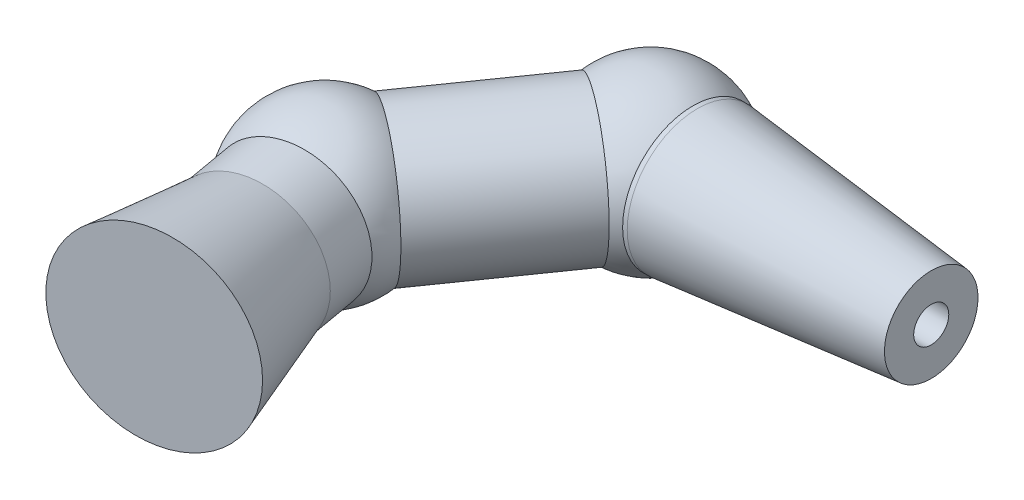
from build123d import *

# Parameters (mm, degrees)
ESQUISSE1_R        = 3
ESQUISSE1_R_2      = 0.75
BOSS_EXTRU_1_DEPTH = 12
CHANFREIN1_SIZE    = 10
CHANFREIN1_SIZE2   = 1
ESQUISSE4_R        = 3
BOSS_EXTRU_2_DEPTH = 10
ESQUISSE8_R        = 3
BOSS_EXTRU_3_DEPTH = 4
ESQUISSE10_R       = 4
BOSS_EXTRU_4_DEPTH = 5
CHANFREIN2_SIZE    = 5
CHANFREIN2_SIZE_2  = 1


with BuildPart() as part:
    # Esquisse1 → Boss.-Extru.1 (new body)
    with BuildSketch(Plane(origin=(0, 0, 0), x_dir=(0, 0, -1), z_dir=(1, 0, 0))):
        Circle(ESQUISSE1_R)
        Circle(ESQUISSE1_R_2, mode=Mode.SUBTRACT)
    extrude(amount=BOSS_EXTRU_1_DEPTH)

    # Chanfrein1
    chanfrein1_edges = [part.edges().sort_by_distance(p)[0] for p in [
        (12, 0, 3),
    ]]
    chanfrein1_side = [part.faces().sort_by_distance(p)[0] for p in [
        (6, 0, 3),
    ]]
    chamfer(chanfrein1_edges, length=CHANFREIN1_SIZE, length2=CHANFREIN1_SIZE2, reference=chanfrein1_side[0])

    # Esquisse2 → Révolution1 (revolve)
    with BuildSketch(Plane.ZY):
        with BuildLine():
            Line((0, 3.5), (0, -3.5))
            ThreePointArc((0, -3.5), (-3.5, 0), (0, 3.5))
        make_face()
    revolve(axis=Axis((0, 3.5, 0), (0, -1, 0)))

    # Esquisse4 → Boss.-Extru.2 (add)
    with BuildSketch(Plane(origin=(0, 0, 0), x_dir=(0, 1, 0), z_dir=(-0.5735764363510443, 0, 0.819152044288993))):
        with Locations(Location((0, 0, 0), (0, 0, 90))):
            Circle(ESQUISSE4_R)
    extrude(amount=BOSS_EXTRU_2_DEPTH)

    # Esquisse7 → Révolution2 (revolve)
    with BuildSketch(Plane(origin=(-5.735764364, 0, 8.191520443), x_dir=(0.8191520442889931, 0, 0.5735764363510444), z_dir=(-0.5735764363510444, 0, 0.8191520442889931))):
        with BuildLine():
            Line((0, 3.5), (0, -3.5))
            ThreePointArc((0, -3.5), (-3.5, 0), (0, 3.5))
        make_face()
    revolve(axis=Axis((-5.735764364, -5.88356871, 8.191520443), (0, 1, 0)))

    # Esquisse8 → Boss.-Extru.3 (add)
    with BuildSketch(Plane(origin=(1.22787804, 0, 6.963642403), x_dir=(0, 1, 0), z_dir=(0.1736481776669342, 0, 0.9848077530122075))):
        with Locations(Location((0, 7.071067812, 0), (0, 0, 90))):
            Circle(ESQUISSE8_R)
    extrude(amount=BOSS_EXTRU_3_DEPTH)

    # Esquisse10 → Boss.-Extru.4 (add)
    with BuildSketch(Plane(origin=(1.92247075, 0, 10.902873415), x_dir=(0.9848077530122075, 0, -0.17364817766693422), z_dir=(0.17364817766693422, 0, 0.9848077530122075))):
        with Locations((-7.071067812, 0)):
            Circle(ESQUISSE10_R)
    extrude(amount=BOSS_EXTRU_4_DEPTH)

    # Chanfrein2
    # the kernel refuses this chamfer: 5, 1 mm, written as the material it takes off along each edge
    with BuildSketch(Plane(origin=(-5.041171653, 0, 12.130751455), x_dir=(0.9848077530122075, 0, -0.17364817766693408), z_dir=(0, -1, 0))) as chanfrein2_piece_1:
        Polygon((4, CHANFREIN2_SIZE), (4 - CHANFREIN2_SIZE_2, 0), (4, 0), align=None)
    revolve(axis=Axis((-5.041171653, 0, 12.130751455), (0.17364817766693422, 0, 0.9848077530122075)), mode=Mode.SUBTRACT)


solid = part.part
